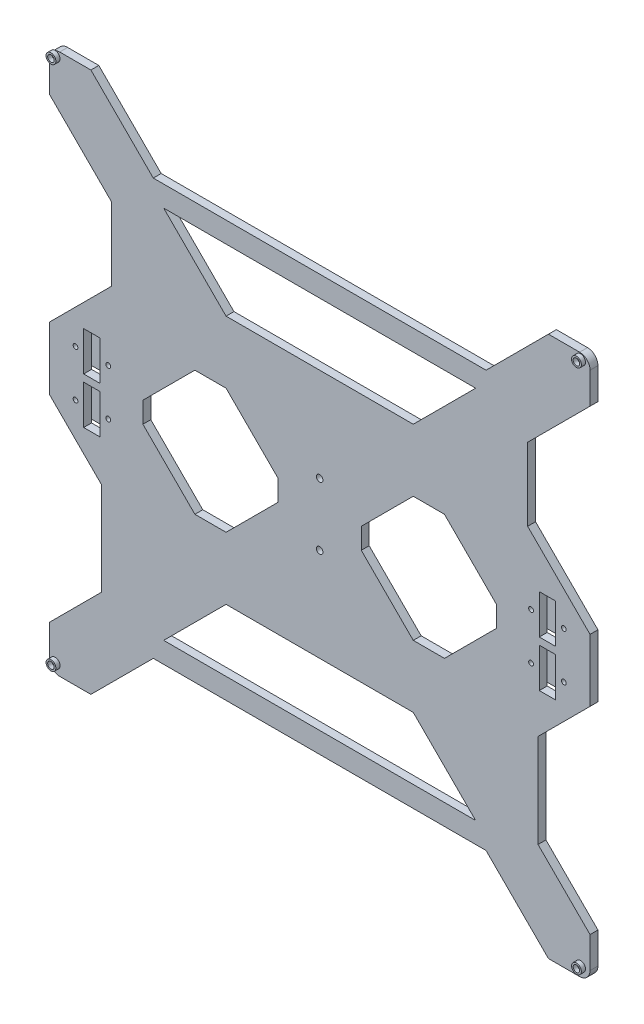
from build123d import *

# Parameters (mm, degrees)
MODEL_R             = 1.4605
MODEL_R_2           = 2
BOSS_EXTRUDE1_DEPTH = 2.413
SKETCH1_W           = 10
SKETCH1_H           = 24
CUT_EXTRUDE1_DEPTH  = 10
SKETCH2_R           = 3
SKETCH2_R_2         = 2
BOSS_EXTRUDE2_DEPTH = 2.54
SKETCH3_W           = 20
SKETCH3_H           = 20
SKETCH3_W_2         = 21.97233685
SKETCH3_H_2         = 68.295186165
BOSS_EXTRUDE3_DEPTH = 1


with BuildPart() as part:
    # Model → Boss-Extrude1 (new, symmetric)
    with BuildSketch(Plane.XY):
        with BuildLine():
            Line((-290.681304326, 108.4317), (-252.581304326, 70.3317))
            Line((-252.581304326, 70.3317), (-252.581304326, 25.8817))
            Line((-252.581304326, 25.8817), (-290.681304326, -12.2183))
            Line((-290.681304326, -12.2183), (-290.681304326, -50.3183))
            Line((-290.681304326, -50.3183), (-258.931304326, -82.0683))
            Line((-258.931304326, -82.0683), (-258.931304326, -139.2183))
            Line((-258.931304326, -139.2183), (-290.681304326, -170.9683))
            Line((-290.681304326, -170.9683), (-290.681304326, -190.0183))
            ThreePointArc((-290.681304326, -190.0183), (-288.821432386, -194.508428061), (-284.331304326, -196.3683))
            Line((-284.331304326, -196.3683), (-265.281304326, -196.3683))
            Line((-265.281304326, -196.3683), (-227.181304326, -158.2683))
            Line((-227.181304326, -158.2683), (-23.981304326, -158.2683))
            Line((-23.981304326, -158.2683), (14.118695674, -196.3683))
            Line((14.118695674, -196.3683), (33.168695674, -196.3683))
            ThreePointArc((33.168695674, -196.3683), (37.658823735, -194.508428061), (39.518695674, -190.0183))
            Line((39.518695674, -190.0183), (39.518695674, -170.9683))
            Line((39.518695674, -170.9683), (7.768695674, -139.2183))
            Line((7.768695674, -139.2183), (7.768695674, -82.0683))
            Line((7.768695674, -82.0683), (22.457936385, -67.37905929))
            Line((22.457936385, -67.37905929), (39.518695674, -50.3183))
            Line((39.518695674, -50.3183), (39.518695674, -12.2183))
            Line((39.518695674, -12.2183), (1.418695674, 25.8817))
            Line((1.418695674, 25.8817), (1.418695674, 70.3317))
            Line((1.418695674, 70.3317), (39.518695674, 108.4317))
            Line((39.518695674, 108.4317), (39.518695674, 127.4817))
            ThreePointArc((39.518695674, 127.4817), (37.658823735, 131.971828061), (33.168695674, 133.8317))
            Line((33.168695674, 133.8317), (14.118695674, 133.8317))
            Line((14.118695674, 133.8317), (-23.981304326, 95.7317))
            Line((-23.981304326, 95.7317), (-227.181304326, 95.7317))
            Line((-227.181304326, 95.7317), (-265.281304326, 133.8317))
            Line((-265.281304326, 133.8317), (-284.331304326, 133.8317))
            ThreePointArc((-284.331304326, 133.8317), (-288.821432386, 131.971828061), (-290.681304326, 127.4817))
            Line((-290.681304326, 127.4817), (-290.681304326, 108.4317))
        make_face()
        with Locations((-287.125304326, -190.6025)):
            Circle(MODEL_R, mode=Mode.SUBTRACT)
        with Locations((-274.681304256, -45.4288)):
            Circle(MODEL_R, mode=Mode.SUBTRACT)
        with Locations((-254.681304256, -45.4288)):
            Circle(MODEL_R, mode=Mode.SUBTRACT)
        Polygon((-68.431304326, -107.4683), (-30.331304326, -145.5683), (-220.831304326, -145.5683), (-182.731304326, -107.4683), align=None, mode=Mode.SUBTRACT)
        with Locations((33.752895674, -190.6025)):
            Circle(MODEL_R, mode=Mode.SUBTRACT)
        with Locations((-125.581304326, -50.3183)):
            Circle(MODEL_R_2, mode=Mode.SUBTRACT)
        Polygon((-68.431304326, -69.3683), (-100.181304326, -37.6183), (-100.181304326, -24.9183), (-68.431304326, 6.8317), (-49.381304326, 6.8317), (-17.631304326, -24.9183), (-17.631304326, -37.6183), (-49.381304326, -69.3683), align=None, mode=Mode.SUBTRACT)
        with Locations((3.518695604, -45.4288)):
            Circle(MODEL_R, mode=Mode.SUBTRACT)
        with Locations((23.518695604, -45.4288)):
            Circle(MODEL_R, mode=Mode.SUBTRACT)
        with Locations((-274.681304256, -17.1078)):
            Circle(MODEL_R, mode=Mode.SUBTRACT)
        with Locations((-254.681304256, -17.1078)):
            Circle(MODEL_R, mode=Mode.SUBTRACT)
        Polygon((-182.731304326, -69.3683), (-201.781304326, -69.3683), (-233.531304326, -37.6183), (-233.531304326, -24.9183), (-201.781304326, 6.8317), (-182.731304326, 6.8317), (-150.981304326, -24.9183), (-150.981304326, -37.6183), align=None, mode=Mode.SUBTRACT)
        with Locations((-287.125304326, 130.2757)):
            Circle(MODEL_R, mode=Mode.SUBTRACT)
        with Locations((-125.581304326, -12.2183)):
            Circle(MODEL_R_2, mode=Mode.SUBTRACT)
        with Locations((3.518695604, -17.1078)):
            Circle(MODEL_R, mode=Mode.SUBTRACT)
        with Locations((23.518695604, -17.1078)):
            Circle(MODEL_R, mode=Mode.SUBTRACT)
        Polygon((-182.731304326, 44.9317), (-220.831304326, 83.0317), (-30.331304326, 83.0317), (-68.431304326, 44.9317), align=None, mode=Mode.SUBTRACT)
        with Locations((33.752895674, 130.2757)):
            Circle(MODEL_R, mode=Mode.SUBTRACT)
    extrude(amount=BOSS_EXTRUDE1_DEPTH, both=True)

    # Sketch1 → Cut-Extrude1 (cut)
    with BuildSketch(Plane.XY.offset(2.413)):
        with Locations((-264.681304256, -45.4288)):
            Rectangle(SKETCH1_W, SKETCH1_H)
        with Locations((-264.681304256, -17.1078)):
            Rectangle(SKETCH1_W, SKETCH1_H)
        with Locations((13.518695604, -17.1078)):
            Rectangle(SKETCH1_W, SKETCH1_H)
        with Locations((13.518695604, -45.4288)):
            Rectangle(SKETCH1_W, SKETCH1_H)
    extrude(amount=-CUT_EXTRUDE1_DEPTH, mode=Mode.SUBTRACT)

    # Sketch2 → Boss-Extrude2 (add)
    # profile 1 of 4: a face of its own
    with BuildSketch(Plane.XY.offset(2.413)):
        with Locations((33.752895674, -190.6025)):
            Circle(SKETCH2_R)
        with Locations((33.752895674, -190.6025)):
            Circle(SKETCH2_R_2, mode=Mode.SUBTRACT)
    # profile 2 of 4: a face of its own
    with BuildSketch(Plane.XY.offset(2.413)):
        with Locations((-287.125304326, -190.6025)):
            Circle(SKETCH2_R)
        with Locations((-287.125304326, -190.6025)):
            Circle(SKETCH2_R_2, mode=Mode.SUBTRACT)
    # profile 3 of 4: a face of its own
    with BuildSketch(Plane.XY.offset(2.413)):
        with Locations((-287.125304326, 130.2757)):
            Circle(SKETCH2_R)
        with Locations((-287.125304326, 130.2757)):
            Circle(SKETCH2_R_2, mode=Mode.SUBTRACT)
    # profile 4 of 4: a face of its own
    with BuildSketch(Plane.XY.offset(2.413)):
        with Locations((33.752895674, 130.2757)):
            Circle(SKETCH2_R)
        with Locations((33.752895674, 130.2757)):
            Circle(SKETCH2_R_2, mode=Mode.SUBTRACT)
    extrude(amount=BOSS_EXTRUDE2_DEPTH)

    # Sketch3 → Boss-Extrude3 (add)
    with BuildSketch(Plane(origin=(0, 0, -2.413), x_dir=(-1, 0, 0), z_dir=(0, 0, -1))):
        with Locations((264.681304256, -17.1078)):
            Rectangle(SKETCH3_W, SKETCH3_H)
        with Locations((264.681304256, -45.4288)):
            Rectangle(SKETCH3_W, SKETCH3_H)
        with Locations((124.01288563, -30.494322806)):
            Rectangle(SKETCH3_W_2, SKETCH3_H_2)
        with Locations((-13.518695604, -17.1078)):
            Rectangle(SKETCH3_W, SKETCH3_H)
        with Locations((-13.518695604, -45.4288)):
            Rectangle(SKETCH3_W, SKETCH3_H)
    extrude(amount=BOSS_EXTRUDE3_DEPTH)


solid = part.part
